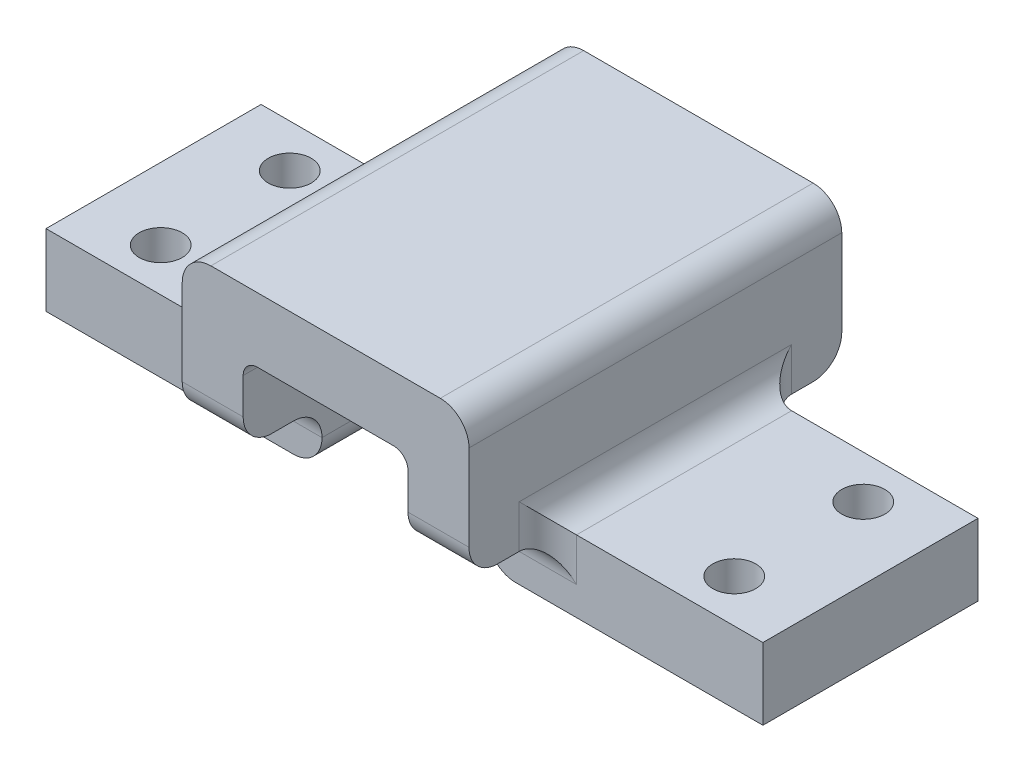
from build123d import *

# Parameters (mm, degrees)
EXTRUDE_1_DEPTH      = 26
EXTRUDE_2_DEPTH      = 8
EXTRUDE_2_DEPTH_BACK = 2
SKETCH_2_W           = 38.5
SKETCH_2_H           = 30
SKETCH_2_R           = 3
FILLET_1_R           = 4
FILLET_2_R           = 4
FILLET_3_R           = 2


with BuildPart() as part:
    # 草圖1 → 填料-伸長1 (new, symmetric)
    with BuildSketch(Plane.XY):
        Polygon((11.5, 1), (11.5, -10), (20, -10), (20, 10), (-20, 10), (-20, -10), (-11.5, -10), (-11.5, 1), align=None)
    extrude(amount=EXTRUDE_1_DEPTH, both=True)

    # 草圖2 → 填料-伸長2 (add, two sides: drawn at the far end of the back side and taken through both)
    # profile 1 of 2: a face of its own
    with BuildSketch(Plane.XZ.offset(10).offset(-EXTRUDE_2_DEPTH_BACK)):
        with Locations((-30.75, 0)):
            Rectangle(SKETCH_2_W, SKETCH_2_H)
        with Locations(Location((-40, 9, 0), (0, 0, 270))):
            Circle(SKETCH_2_R, mode=Mode.SUBTRACT)
        with Locations(Location((-40, -9, 0), (0, 0, 90))):
            Circle(SKETCH_2_R, mode=Mode.SUBTRACT)
    # profile 2 of 2: a face of its own
    with BuildSketch(Plane.XZ.offset(10).offset(-EXTRUDE_2_DEPTH_BACK)):
        with Locations((30.75, 0)):
            Rectangle(SKETCH_2_W, SKETCH_2_H)
        with Locations(Location((40, 9, 0), (0, 0, 90))):
            Circle(SKETCH_2_R, mode=Mode.SUBTRACT)
        with Locations(Location((40, -9, 0), (0, 0, 270))):
            Circle(SKETCH_2_R, mode=Mode.SUBTRACT)
    extrude(amount=EXTRUDE_2_DEPTH + EXTRUDE_2_DEPTH_BACK)

    # 圓角1
    fillet_1_edges = [part.edges().sort_by_distance(p)[0] for p in [
        (20, 10, 0),
        (-20, 10, 0),
        (-11.5, -18, 0),
        (-20, -8, 0),
        (-15.75, -10, -15),
        (15.75, -10, -15),
        (-15.75, -10, 15),
        (15.75, -10, 15),
        (20, -8, 0),
        (11.5, -18, 0),
        (-20, -9, 15),
        (-20, -9, -15),
        (20, -9, -15),
        (20, -9, 15),
    ]]
    fillet(fillet_1_edges, radius=FILLET_1_R - 0.0001)  # a hair under: the kernel refuses the full size

    # 圓角2
    fillet_2_edges = [part.edges().sort_by_distance(p)[0] for p in [
        (-15.75, -10, -26),
        (15.75, -10, 26),
        (15.75, -10, -26),
        (-15.75, -10, 26),
    ]]
    fillet(fillet_2_edges, radius=FILLET_2_R)

    # 圓角3
    fillet_3_edges = [part.edges().sort_by_distance(p)[0] for p in [
        (11.5, 1, 0),
        (-11.5, 1, 0),
    ]]
    fillet(fillet_3_edges, radius=FILLET_3_R)


solid = part.part
